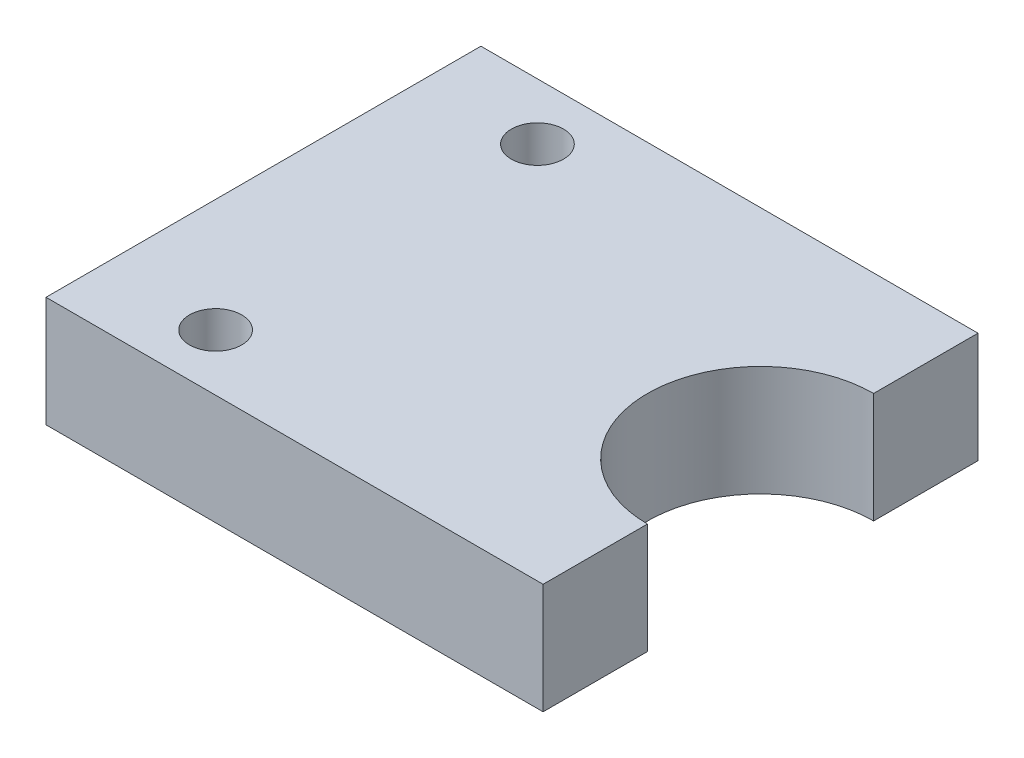
from build123d import *

# Parameters (mm, degrees)
CROQUIS2_R              = 3
SALIENTE_EXTRUIR1_DEPTH = 12.7


with BuildPart() as part:
    # Croquis2 → Saliente-Extruir1 (new body)
    with BuildSketch(Plane(origin=(0, 0, 0), x_dir=(1, 0, 0), z_dir=(0, 1, 0))):
        with BuildLine():
            Line((0, 25), (-57.15, 25))
            Line((-57.15, 25), (-57.15, -25))
            Line((-57.15, -25), (0, -25))
            Line((0, -25), (0, -13))
            ThreePointArc((0, -13), (-13, 0), (0, 13))
            Line((0, 13), (0, 25))
        make_face()
        with Locations((-44.15, -18.5)):
            Circle(CROQUIS2_R, mode=Mode.SUBTRACT)
        with Locations((-44.15, 18.5)):
            Circle(CROQUIS2_R, mode=Mode.SUBTRACT)
    extrude(amount=SALIENTE_EXTRUIR1_DEPTH)


solid = part.part
